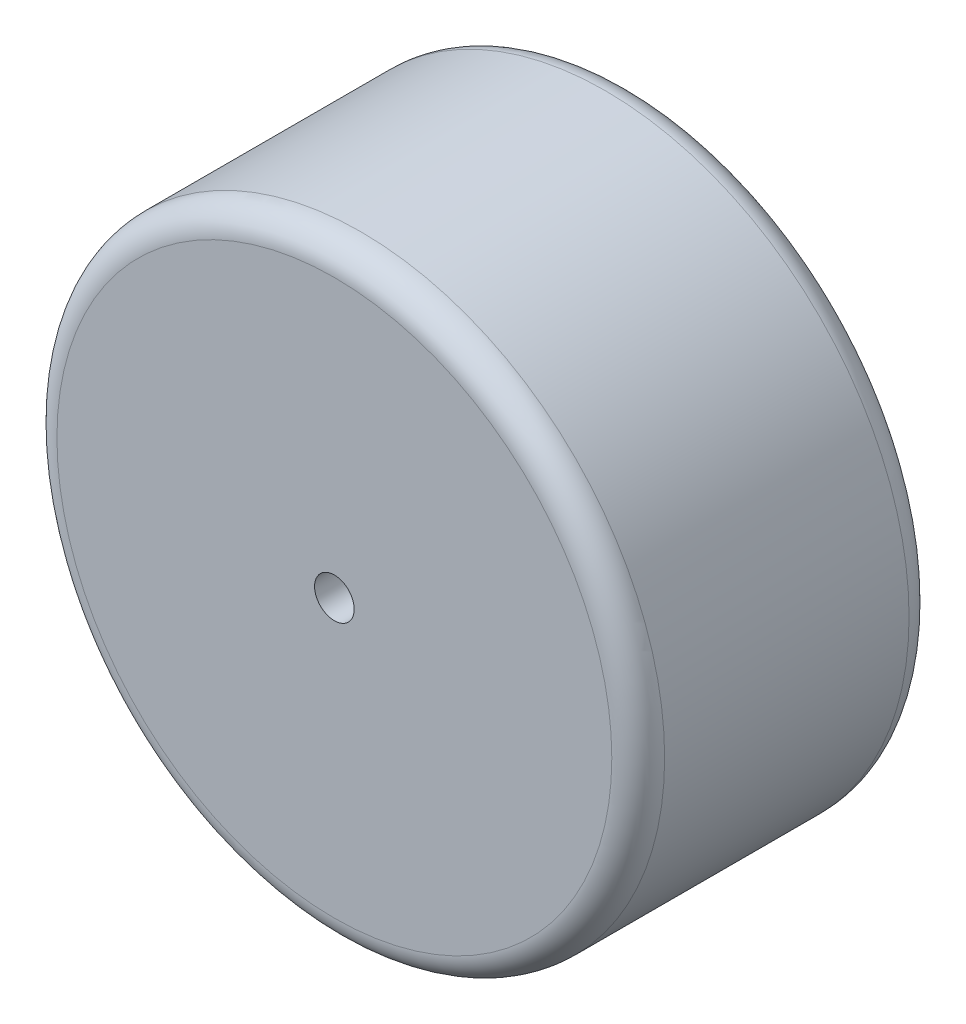
from build123d import *

# Parameters (mm, degrees)
SKETCH1_R           = 23
BOSS_EXTRUDE1_DEPTH = 22.5
SKETCH3_R           = 1.5
CUT_EXTRUDE1_DEPTH  = 69.417650925
FILLET1_R           = 2


with BuildPart() as part:
    # Sketch1 → Boss-Extrude1 (new body)
    with BuildSketch(Plane(origin=(0, -10, 10), x_dir=(1, 0, 0), z_dir=(0, 0, -1))):
        with Locations((-29.725277397, 4.346620751)):
            Circle(SKETCH1_R)
    extrude(amount=BOSS_EXTRUDE1_DEPTH)

    # Sketch3 → Cut-Extrude1 (cut, through all)
    with BuildSketch(Plane.XY.offset(10)):
        with Locations((-29.725277397, -14.346620751)):
            Circle(SKETCH3_R)
    extrude(amount=-CUT_EXTRUDE1_DEPTH, mode=Mode.SUBTRACT)

    # Fillet1
    fillet1_edges = [part.edges().sort_by_distance(p)[0] for p in [
        (-52.725277397, -14.346620751, -12.5),
        (-52.725277397, -14.346620751, 10),
    ]]
    fillet(fillet1_edges, radius=FILLET1_R)


solid = part.part
